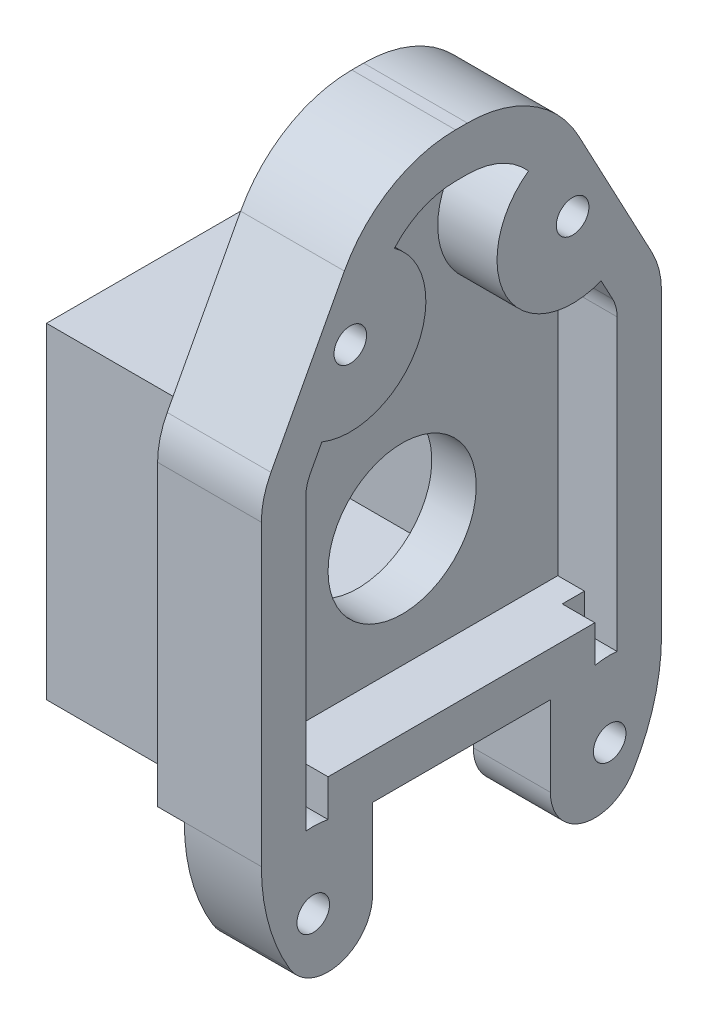
from build123d import *

# Parameters (mm, degrees)
BOSS_EXTRUDE1_DEPTH = 7
FILLET1_R           = 8.5
FILLET2_R           = 5.5
FILLET3_R           = 13.5
SKETCH3_W           = 27
SKETCH3_H           = 13.5
CUT_EXTRUDE1_DEPTH  = 1.8
CUT_EXTRUDE5_REACH  = 37.882
SKETCH12_W          = 12
SKETCH12_H          = 13.5
CUT_EXTRUDE6_REACH  = 37.882
SKETCH13_R          = 1.1
SKETCH17_R          = 2.1
CUT_EXTRUDE14_DEPTH = 4
FILLET4_R           = 3
SHELL2_START        = 3
SHELL2_DEPTH        = 4
SHELL2_START_2      = 4.8
SHELL2_2_DEPTH      = 2.2
SKETCH18_W          = 22
SKETCH18_H          = 22
BOSS_EXTRUDE2_DEPTH = 10
SKETCH19_W          = 18
SKETCH19_H          = 18
CUT_EXTRUDE15_DEPTH = 10
SKETCH20_R          = 5
CUT_EXTRUDE16_DEPTH = 3


# Read off the part's stored shape, not the designer's step: Shell2
with BuildPart() as part:
    # Sketch2 → Boss-Extrude1 (new body)
    with BuildSketch(Plane(origin=(0, 0, 0), x_dir=(0, 0, -1), z_dir=(1, 0, 0))):
        Polygon((-13.5, -17.5), (13.5, -17.5), (13.5, 17.5), (5.5, 32.5), (-5.5, 32.5), (-13.5, 17.5), align=None)
    extrude(amount=BOSS_EXTRUDE1_DEPTH)

    # Fillet1
    fillet1_edges = [part.edges().sort_by_distance(p)[0] for p in [
        (3.5, 32.5, 5.5),
        (3.5, 32.5, -5.5),
    ]]
    fillet(fillet1_edges, radius=FILLET1_R)

    # Fillet2
    fillet2_edges = [part.edges().sort_by_distance(p)[0] for p in [
        (3.5, 17.5, -13.5),
        (3.5, 17.5, 13.5),
    ]]
    fillet(fillet2_edges, radius=FILLET2_R)

    # Fillet3
    fillet3_edges = [part.edges().sort_by_distance(p)[0] for p in [
        (3.5, -17.5, 13.5),
        (3.5, -17.5, -13.5),
    ]]
    fillet(fillet3_edges, radius=FILLET3_R - 0.0001)  # a hair under: the kernel refuses the full size

    # Sketch3 → Cut-Extrude1 (cut)
    with BuildSketch(Plane.ZY):
        with Locations((0, -10.75)):
            Rectangle(SKETCH3_W, SKETCH3_H)
    extrude(amount=-CUT_EXTRUDE1_DEPTH, mode=Mode.SUBTRACT)

    # Sketch12 → Cut-Extrude5 (cut, up to next)
    with BuildSketch(Plane(origin=(7, 0, 0), x_dir=(0, 0, -1), z_dir=(1, 0, 0)), mode=Mode.PRIVATE) as cut_extrude5_sk1:
        with Locations((0, -10.75)):
            Rectangle(SKETCH12_W, SKETCH12_H)
    cut_extrude5_tool1 = extrude(cut_extrude5_sk1.sketch, amount=-CUT_EXTRUDE5_REACH, mode=Mode.PRIVATE) & part.part
    add(cut_extrude5_tool1.solids().sort_by_distance((7, -10.75, 0))[0], mode=Mode.SUBTRACT)

    # Sketch13 → Cut-Extrude6 (cut, up to next)
    with BuildSketch(Plane.ZY, mode=Mode.PRIVATE) as cut_extrude6_sk1:
        with Locations((-7.5, 23.5)):
            Circle(SKETCH13_R)
    cut_extrude6_tool1 = extrude(cut_extrude6_sk1.sketch, amount=-CUT_EXTRUDE6_REACH, mode=Mode.PRIVATE) & part.part
    # Sketch13 → Cut-Extrude6 (cut, up to next)
    with BuildSketch(Plane.ZY, mode=Mode.PRIVATE) as cut_extrude6_sk2:
        with Locations((-10, -8.5)):
            Circle(SKETCH13_R)
    cut_extrude6_tool2 = extrude(cut_extrude6_sk2.sketch, amount=-CUT_EXTRUDE6_REACH, mode=Mode.PRIVATE) & part.part
    # Sketch13 → Cut-Extrude6 (cut, up to next)
    with BuildSketch(Plane.ZY, mode=Mode.PRIVATE) as cut_extrude6_sk3:
        with Locations((10, -8.5)):
            Circle(SKETCH13_R)
    cut_extrude6_tool3 = extrude(cut_extrude6_sk3.sketch, amount=-CUT_EXTRUDE6_REACH, mode=Mode.PRIVATE) & part.part
    # Sketch13 → Cut-Extrude6 (cut, up to next)
    with BuildSketch(Plane.ZY, mode=Mode.PRIVATE) as cut_extrude6_sk4:
        with Locations((7.5, 23.5)):
            Circle(SKETCH13_R)
    cut_extrude6_tool4 = extrude(cut_extrude6_sk4.sketch, amount=-CUT_EXTRUDE6_REACH, mode=Mode.PRIVATE) & part.part
    add(cut_extrude6_tool1.solids().sort_by_distance((0, 23.5, -7.5))[0], mode=Mode.SUBTRACT)
    add(cut_extrude6_tool2.solids().sort_by_distance((0, -8.5, -10))[0], mode=Mode.SUBTRACT)
    add(cut_extrude6_tool3.solids().sort_by_distance((0, -8.5, 10))[0], mode=Mode.SUBTRACT)
    add(cut_extrude6_tool4.solids().sort_by_distance((0, 23.5, 7.5))[0], mode=Mode.SUBTRACT)

    # Sketch17 → Cut-Extrude14 (cut)
    with BuildSketch(Plane.ZY):
        with Locations((-7.5, 23.5)):
            Circle(SKETCH17_R)
        with Locations((7.5, 23.5)):
            Circle(SKETCH17_R)
        with Locations((-10, -8.5)):
            Circle(SKETCH17_R)
        with Locations((10, -8.5)):
            Circle(SKETCH17_R)
    extrude(amount=-CUT_EXTRUDE14_DEPTH, mode=Mode.SUBTRACT)

    # Fillet4
    fillet4_edges = [part.edges().sort_by_distance(p)[0] for p in [
        (4.4, -16.093424605, -6),
        (4.4, -16.093424605, 6),
    ]]
    fillet(fillet4_edges, radius=FILLET4_R)

    # Shell2 outline → Shell2 (cut)
    with BuildSketch(Plane.YZ.offset(SHELL2_START)):
        with BuildLine():
            Line((17.301470588, -10.205882353), (18.775176121, -9.419906069))
            ThreePointArc((18.775176121, -9.419906069), (21.033978224, -3.035838645), (27.640649185, -4.522580929))
            ThreePointArc((27.640649185, -4.522580929), (29.013659867, -2.661241858), (29.5, -0.4))
            Line((29.5, -0.4), (29.5, 0.4))
            ThreePointArc((29.5, 0.4), (29.013659867, 2.661241858), (27.640649185, 4.522580929))
            ThreePointArc((27.640649185, 4.522580929), (21.033978224, 3.035838645), (18.775176121, 9.419906069))
            Line((18.775176121, 9.419906069), (17.301470588, 10.205882353))
            ThreePointArc((17.301470588, 10.205882353), (16.731339062, 10.42535625), (16.125, 10.5))
            Line((16.125, 10.5), (-1, 10.5))
            Line((-1, 10.5), (-1, -10.5))
            Line((-1, -10.5), (16.125, -10.5))
            ThreePointArc((16.125, -10.5), (16.731339062, -10.42535625), (17.301470588, -10.205882353))
        make_face()
    extrude(amount=SHELL2_DEPTH, mode=Mode.SUBTRACT)

    # Shell2 2 outline → Shell2 2 (cut)
    with BuildSketch(Plane.YZ.offset(SHELL2_START_2)):
        with BuildLine():
            Line((-3.424568984, -10.5), (-1, -10.5))
            Line((-1, -10.5), (-1, -9))
            Line((-1, -9), (-3.4990001, -9))
            ThreePointArc((-3.4990001, -9), (-3.406267086, -9.747245183), (-3.424568984, -10.5))
        make_face()
        with BuildLine():
            Line((-3.4990001, 9), (-1, 9))
            Line((-1, 9), (-1, 10.5))
            Line((-1, 10.5), (-3.424568984, 10.5))
            ThreePointArc((-3.424568984, 10.5), (-3.406267086, 9.747245183), (-3.4990001, 9))
        make_face()
    extrude(amount=SHELL2_2_DEPTH, mode=Mode.SUBTRACT)

    # Sketch18 → Boss-Extrude2 (add)
    with BuildSketch(Plane.ZY):
        with Locations((0, 7)):
            Rectangle(SKETCH18_W, SKETCH18_H)
    extrude(amount=BOSS_EXTRUDE2_DEPTH)

    # Sketch19 → Cut-Extrude15 (cut)
    with BuildSketch(Plane.ZY.offset(10)):
        with Locations((0, 7)):
            Rectangle(SKETCH19_W, SKETCH19_H)
    extrude(amount=-CUT_EXTRUDE15_DEPTH, mode=Mode.SUBTRACT)

    # Sketch20 → Cut-Extrude16 (cut)
    with BuildSketch(Plane.ZY):
        with Locations((0, 7)):
            Circle(SKETCH20_R)
    extrude(amount=-CUT_EXTRUDE16_DEPTH, mode=Mode.SUBTRACT)


solid = part.part
